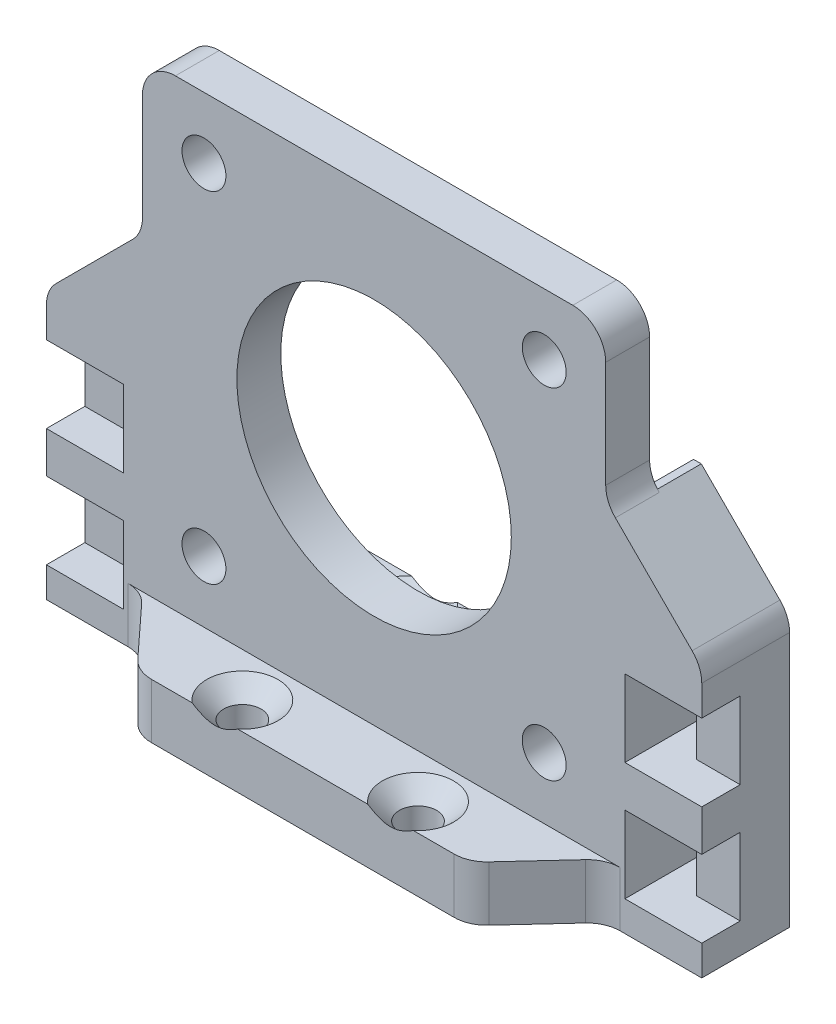
from build123d import *
from OCP.BRepFilletAPI import BRepFilletAPI_MakeChamfer

# Parameters (mm, degrees)
SKETCH1_W                                       = 42.2
SKETCH1_H                                       = 42.2
SKETCH1_R                                       = 12.5
SKETCH1_R_2                                     = 2
BOSS_EXTRUDE1_DEPTH                             = 2
SKETCH2_W                                       = 42.2
SKETCH2_H                                       = 20
SKETCH2_R                                       = 1.625
BOSS_EXTRUDE2_DEPTH                             = 5
BOSS_EXTRUDE3_DEPTH                             = 3.5
BOSS_EXTRUDE3_DEPTH_BACK                        = 2
SKETCH3_W                                       = 8.75
SKETCH3_H                                       = 23.25
SKETCH3_W_2                                     = 2.5
SKETCH3_H_2                                     = 7
CUT_EXTRUDE1_START                              = -3.5
SKETCH4_W                                       = 4.5
SKETCH4_H                                       = 7
CUT_EXTRUDE1_DEPTH                              = 3.5
CSK_FOR_M3_FLAT_HEAD_MACHINE_SCREW1_D           = 3.4
CSK_FOR_M3_FLAT_HEAD_MACHINE_SCREW1_CSINK_D     = 6.5
CSK_FOR_M3_FLAT_HEAD_MACHINE_SCREW1_CSINK_ANGLE = 90
SKETCH10_W                                      = 8.75
SKETCH10_H                                      = 23.25
SKETCH10_W_2                                    = 2.5
SKETCH10_H_2                                    = 7
BOSS_EXTRUDE4_DEPTH                             = 4
CUT_EXTRUDE3_DEPTH                              = 10
CHAMFER1_SIZE                                   = 10
FILLET2_R                                       = 3
FILLET3_R                                       = 3
FILLET4_R                                       = 3
CHAMFER2_SIZE                                   = 1
CHAMFER2_SIZE2                                  = 0.707106781
CHAMFER3_SIZE                                   = 0.5


with BuildPart() as part:
    # Sketch1 → Boss-Extrude1 (new, symmetric)
    with BuildSketch(Plane.XY.offset(1.5)):
        Rectangle(SKETCH1_W, SKETCH1_H)
        Circle(SKETCH1_R, mode=Mode.SUBTRACT)
        with Locations((15.5, 15.5)):
            Circle(SKETCH1_R_2, mode=Mode.SUBTRACT)
        with Locations((15.5, -15.5)):
            Circle(SKETCH1_R_2, mode=Mode.SUBTRACT)
        with Locations((-15.5, -15.5)):
            Circle(SKETCH1_R_2, mode=Mode.SUBTRACT)
        with Locations((-15.5, 15.5)):
            Circle(SKETCH1_R_2, mode=Mode.SUBTRACT)
    extrude(amount=BOSS_EXTRUDE1_DEPTH, both=True)

    # Sketch2 → Boss-Extrude2 (add)
    with BuildSketch(Plane.XZ.offset(21.1)):
        Rectangle(SKETCH2_W, SKETCH2_H)
        with Locations(Location((8, 7.5, 0), (0, 0, 270))):
            Circle(SKETCH2_R, mode=Mode.SUBTRACT)
        with Locations(Location((8, -7.5, 0), (0, 0, 270))):
            Circle(SKETCH2_R, mode=Mode.SUBTRACT)
        with Locations(Location((-8, -7.5, 0), (0, 0, 270))):
            Circle(SKETCH2_R, mode=Mode.SUBTRACT)
        with Locations(Location((-8, 7.5, 0), (0, 0, 270))):
            Circle(SKETCH2_R, mode=Mode.SUBTRACT)
    extrude(amount=BOSS_EXTRUDE2_DEPTH)

    # Sketch3 → Boss-Extrude3 (add, two sides: drawn at the far end of the back side and taken through both)
    # profile 1 of 2: a face of its own
    with BuildSketch(Plane.XY.offset(-BOSS_EXTRUDE3_DEPTH_BACK)):
        with Locations((-25.475, -14.475)):
            Rectangle(SKETCH3_W, SKETCH3_H)
        with Locations((-24.1, -9.1)):
            Rectangle(SKETCH3_W_2, SKETCH3_H_2, mode=Mode.SUBTRACT)
        with Locations((-24.1, -19.85)):
            Rectangle(SKETCH3_W_2, SKETCH3_H_2, mode=Mode.SUBTRACT)
    # profile 2 of 2: a face of its own
    with BuildSketch(Plane.XY.offset(-BOSS_EXTRUDE3_DEPTH_BACK)):
        with Locations((25.475, -14.475)):
            Rectangle(SKETCH3_W, SKETCH3_H)
        with Locations((24.1, -9.1)):
            Rectangle(SKETCH3_W_2, SKETCH3_H_2, mode=Mode.SUBTRACT)
        with Locations((24.1, -19.85)):
            Rectangle(SKETCH3_W_2, SKETCH3_H_2, mode=Mode.SUBTRACT)
    extrude(amount=BOSS_EXTRUDE3_DEPTH + BOSS_EXTRUDE3_DEPTH_BACK)

    # Sketch4 → Cut-Extrude1 (cut)
    with BuildSketch(Plane.XY.offset(3.5).offset(CUT_EXTRUDE1_START)):
        with Locations((-27.6, -9.1)):
            Rectangle(SKETCH4_W, SKETCH4_H)
        with Locations((-27.6, -19.85)):
            Rectangle(SKETCH4_W, SKETCH4_H)
        with Locations((27.6, -19.85)):
            Rectangle(SKETCH4_W, SKETCH4_H)
        with Locations((27.6, -9.1)):
            Rectangle(SKETCH4_W, SKETCH4_H)
    extrude(amount=CUT_EXTRUDE1_DEPTH, mode=Mode.SUBTRACT)

    # CSK for M3 Flat Head Machine Screw1 (through all)
    with Locations(Plane(origin=(0, -21.1, 0), x_dir=(1, 0, 0), z_dir=(0, 1, 0))):
        with Locations((-8, -7.5), (8, -7.5), (-8, 7.5), (8, 7.5)):
            CounterSinkHole(CSK_FOR_M3_FLAT_HEAD_MACHINE_SCREW1_D / 2, CSK_FOR_M3_FLAT_HEAD_MACHINE_SCREW1_CSINK_D / 2, counter_sink_angle=CSK_FOR_M3_FLAT_HEAD_MACHINE_SCREW1_CSINK_ANGLE)

    # Sketch10 → Boss-Extrude4 (add)
    # profile 1 of 2: a face of its own
    with BuildSketch(Plane(origin=(0, 0, -0.5), x_dir=(-1, 0, 0), z_dir=(0, 0, -1))):
        with Locations((25.475, -14.475)):
            Rectangle(SKETCH10_W, SKETCH10_H)
        with Locations((24.1, -19.85)):
            Rectangle(SKETCH10_W_2, SKETCH10_H_2, mode=Mode.SUBTRACT)
        with Locations((24.1, -9.1)):
            Rectangle(SKETCH10_W_2, SKETCH10_H_2, mode=Mode.SUBTRACT)
    # profile 2 of 2: a face of its own
    with BuildSketch(Plane(origin=(0, 0, -0.5), x_dir=(-1, 0, 0), z_dir=(0, 0, -1))):
        with Locations((-25.475, -14.475)):
            Rectangle(SKETCH10_W, SKETCH10_H)
        with Locations((-24.1, -19.85)):
            Rectangle(SKETCH10_W_2, SKETCH10_H_2, mode=Mode.SUBTRACT)
        with Locations((-24.1, -9.1)):
            Rectangle(SKETCH10_W_2, SKETCH10_H_2, mode=Mode.SUBTRACT)
    extrude(amount=BOSS_EXTRUDE4_DEPTH)

    # Sketch11 → Cut-Extrude3 (cut)
    with BuildSketch(Plane(origin=(0, -21.1, 0), x_dir=(1, 0, 0), z_dir=(0, 1, 0))):
        Polygon((-21.1, -3.5), (-15.1, -10), (-21.1, -10), align=None)
        Polygon((15.1, -10), (21.1, -10), (21.1, -3.5), align=None)
        Polygon((-21.1, 10), (-21.1, 4.5), (-15.1, 10), align=None)
        Polygon((21.1, 4.5), (21.1, 10), (15.1, 10), align=None)
    extrude(amount=-CUT_EXTRUDE3_DEPTH, mode=Mode.SUBTRACT)

    # Chamfer1
    # the kernel refuses this chamfer: 10 mm, written as the material it adds along each edge
    with BuildSketch(Plane(origin=(-21.1, -2.85, 3.5), x_dir=(0.027495876610585973, 0.9996219169112968, 0), z_dir=(0, 0, -1))) as chamfer1_piece_1_section:
        Polygon((CHAMFER1_SIZE * 0.999621916911, -CHAMFER1_SIZE * 0.0274958766106), (-CHAMFER1_SIZE * 0.0274958766106, -CHAMFER1_SIZE * 0.999621916911), (0, 0), align=None)
    chamfer1_piece_1 = extrude(amount=4, mode=Mode.PRIVATE)
    chamfer1_piece_1 = split(chamfer1_piece_1, bisect_by=Plane(origin=(-21.1, 0.400261982, 1.5), z_dir=(-1, 0, 0)), keep=Keep.TOP, mode=Mode.PRIVATE)
    chamfer1_piece_1 = split(chamfer1_piece_1, bisect_by=Plane(origin=(-29.85, 0.400261982, 1.5), z_dir=(1, 0, 0)), keep=Keep.TOP, mode=Mode.PRIVATE)
    add(chamfer1_piece_1)
    with BuildSketch(Plane(origin=(-21.1, -2.85, 3.5), x_dir=(0.027495876610585973, 0.9996219169112968, 0), z_dir=(0, 0, -1))) as chamfer1_piece_2_section:
        Polygon((CHAMFER1_SIZE * 0.999621916911, -CHAMFER1_SIZE * 0.0274958766106), (-CHAMFER1_SIZE * 0.0274958766106, -CHAMFER1_SIZE * 0.999621916911), (0, 0), align=None)
    chamfer1_piece_2 = extrude(amount=29.71682988, mode=Mode.PRIVATE)
    chamfer1_piece_2 = split(chamfer1_piece_2, bisect_by=Plane(origin=(-24.403786138, 0.400261982, -0.5), z_dir=(0, 0, -1)), keep=Keep.TOP, mode=Mode.PRIVATE)
    chamfer1_piece_2 = split(chamfer1_piece_2, bisect_by=Plane(origin=(-21.1, 0.400261982, -2.5), z_dir=(-1, 0, 0)), keep=Keep.TOP, mode=Mode.PRIVATE)
    chamfer1_piece_2 = split(chamfer1_piece_2, bisect_by=Plane(origin=(-24.403786138, 0.400261982, -4.5), z_dir=(0, 0, 1)), keep=Keep.TOP, mode=Mode.PRIVATE)
    chamfer1_piece_2 = split(chamfer1_piece_2, bisect_by=Plane(origin=(-29.85, 0.400261982, -2.5), z_dir=(1, 0, 0)), keep=Keep.TOP, mode=Mode.PRIVATE)
    add(chamfer1_piece_2)
    with BuildSketch(Plane(origin=(21.1, -2.85, 3.5), x_dir=(-0.027495876610585973, 0.9996219169112968, 0), z_dir=(0, 0, -1))) as chamfer1_piece_3_section:
        Polygon((CHAMFER1_SIZE * 0.999621916911, CHAMFER1_SIZE * 0.0274958766106), (-CHAMFER1_SIZE * 0.0274958766106, CHAMFER1_SIZE * 0.999621916911), (0, 0), align=None)
    chamfer1_piece_3 = extrude(amount=4, mode=Mode.PRIVATE)
    chamfer1_piece_3 = split(chamfer1_piece_3, bisect_by=Plane(origin=(21.1, 0.400261982, 1.5), z_dir=(1, 0, 0)), keep=Keep.TOP, mode=Mode.PRIVATE)
    chamfer1_piece_3 = split(chamfer1_piece_3, bisect_by=Plane(origin=(29.85, 0.400261982, 1.5), z_dir=(-1, 0, 0)), keep=Keep.TOP, mode=Mode.PRIVATE)
    add(chamfer1_piece_3)
    with BuildSketch(Plane(origin=(21.1, -2.85, 3.5), x_dir=(-0.027495876610585973, 0.9996219169112968, 0), z_dir=(0, 0, -1))) as chamfer1_piece_4_section:
        Polygon((CHAMFER1_SIZE * 0.999621916911, CHAMFER1_SIZE * 0.0274958766106), (-CHAMFER1_SIZE * 0.0274958766106, CHAMFER1_SIZE * 0.999621916911), (0, 0), align=None)
    chamfer1_piece_4 = extrude(amount=29.71682988, mode=Mode.PRIVATE)
    chamfer1_piece_4 = split(chamfer1_piece_4, bisect_by=Plane(origin=(24.403786138, 0.400261982, -0.5), z_dir=(0, 0, -1)), keep=Keep.TOP, mode=Mode.PRIVATE)
    chamfer1_piece_4 = split(chamfer1_piece_4, bisect_by=Plane(origin=(21.1, 0.400261982, -2.5), z_dir=(1, 0, 0)), keep=Keep.TOP, mode=Mode.PRIVATE)
    chamfer1_piece_4 = split(chamfer1_piece_4, bisect_by=Plane(origin=(24.403786138, 0.400261982, -4.5), z_dir=(0, 0, 1)), keep=Keep.TOP, mode=Mode.PRIVATE)
    chamfer1_piece_4 = split(chamfer1_piece_4, bisect_by=Plane(origin=(29.85, 0.400261982, -2.5), z_dir=(-1, 0, 0)), keep=Keep.TOP, mode=Mode.PRIVATE)
    add(chamfer1_piece_4)

    # Fillet2
    fillet2_edges = [part.edges().sort_by_distance(p)[0] for p in [
        (21.1, 7.15, 1.5),
        (-21.1, 7.15, 1.5),
        (29.85, -1.6, -0.5),
        (-29.85, -1.6, -0.5),
    ]]
    fillet(fillet2_edges, radius=FILLET2_R)

    # Fillet3
    fillet3_edges = [part.edges().sort_by_distance(p)[0] for p in [
        (-21.1, 21.1, 1.5),
        (21.1, 21.1, 1.5),
    ]]
    fillet(fillet3_edges, radius=FILLET3_R)

    # Fillet4
    fillet4_edges = [part.edges().sort_by_distance(p)[0] for p in [
        (21.1, -23.6, -4.5),
        (-21.1, -23.6, -4.5),
        (-15.1, -23.6, 10),
        (15.1, -23.6, 10),
        (-15.1, -23.6, -10),
        (15.1, -23.6, -10),
        (-21.1, -23.6, 3.5),
        (21.1, -23.6, 3.5),
    ]]
    fillet(fillet4_edges, radius=FILLET4_R)

    # Chamfer2: one chamfer whose edges measure the first distance from different faces: ONE call of the kernel's chamfer builder (chamfer() names one face for all edges)
    chamfer2_edges_1 = [part.edges().sort_by_distance(p)[0] for p in [
        (21.1, 7.15, -2.5),
    ]]
    chamfer2_side_1 = [part.faces().sort_by_distance(p)[0] for p in [
        (25.242344349, 3.007655651, -0.618229543),
    ]]
    chamfer2_edges_2 = [part.edges().sort_by_distance(p)[0] for p in [
        (-21.1, 7.15, -2.5),
    ]]
    chamfer2_side_2 = [part.faces().sort_by_distance(p)[0] for p in [
        (-25.242344349, 3.007655651, -0.618229543),
    ]]
    chamfer2 = BRepFilletAPI_MakeChamfer(part.part.solid().wrapped)
    for e in chamfer2_edges_1:
        chamfer2.Add(CHAMFER2_SIZE, CHAMFER2_SIZE2, e.wrapped, chamfer2_side_1[0].wrapped)  # the first distance lies on this face
    for e in chamfer2_edges_2:
        chamfer2.Add(CHAMFER2_SIZE, CHAMFER2_SIZE2, e.wrapped, chamfer2_side_2[0].wrapped)  # the first distance lies on this face
    add(Compound.cast(chamfer2.Shape()), mode=Mode.REPLACE)

    # Chamfer3
    chamfer3_edges = [part.edges().sort_by_distance(p)[0] for p in [
        (25.35, -9.1, 0),
        (25.35, -19.85, 0),
        (-25.35, -19.85, 0),
        (-25.35, -9.1, 0),
    ]]
    chamfer(chamfer3_edges, length=CHAMFER3_SIZE)


solid = part.part
